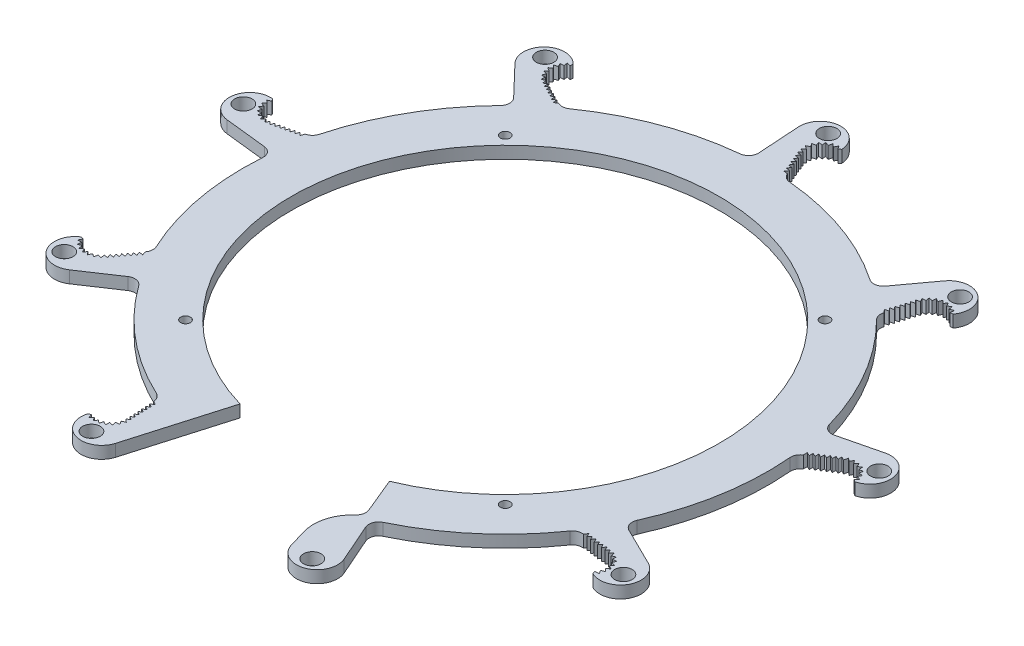
from build123d import *

# Parameters (mm, degrees)
SKETCH1_R           = 68.58
SKETCH1_R_2         = 55.88
BOSS_EXTRUDE1_DEPTH = 3.175
BOSS_EXTRUDE2_START = -3.175
BOSS_EXTRUDE2_DEPTH = 3.175
CIRPATTERN1_COUNT   = 9
SKETCH4_R           = 1.27
CUT_EXTRUDE1_DEPTH  = 124.088082607
CIRPATTERN14_COUNT  = 4
CUT_EXTRUDE4_DEPTH  = 124.088082607
BOSS_EXTRUDE4_START = -3.175
BOSS_EXTRUDE4_DEPTH = 3.175
SKETCH11_R          = 0.0635
CUT_EXTRUDE6_DEPTH  = 124.088082607
CRVPATTERN8_DEPTH   = 3.175
CIRPATTERN15_COUNT  = 9
CUT_EXTRUDE7_DEPTH  = 124.088082607
SKETCH3_R           = 2.286
CUT_EXTRUDE8_DEPTH  = 124.088082607
CIRPATTERN16_COUNT  = 9


# Read off the part's stored shape, not the designer's step: CrvPattern8
with BuildPart() as part:
    # Sketch1 → Boss-Extrude1 (new body)
    with BuildSketch(Plane(origin=(0, 0, 0), x_dir=(1, 0, 0), z_dir=(0, 1, 0))):
        with Locations(Location((0, 0, 0), (0, 0, 270))):
            Circle(SKETCH1_R)
        with Locations(Location((0, 0, 0), (0, 0, 270))):
            Circle(SKETCH1_R_2, mode=Mode.SUBTRACT)
    extrude(amount=BOSS_EXTRUDE1_DEPTH)

    # Sketch2 → Boss-Extrude2 (add)
    with BuildSketch(Plane(origin=(0, 3.175, 0), x_dir=(1, 0, 0), z_dir=(0, 1, 0)).offset(BOSS_EXTRUDE2_START)):
        with BuildLine():
            Line((-4.648503105, 70.922452149), (-5.367925957, 81.898723786))
            ThreePointArc((-5.367925957, 81.898723786), (0, 87.63), (5.367925957, 81.898723786))
            ThreePointArc((5.367925957, 81.898723786), (1.585103244, 80.66312392), (0.966324082, 76.732021396))
            Line((0.966324082, 76.732021396), (3.81, 69.87951531))
            ThreePointArc((3.81, 69.87951531), (4.65537594, 68.803759817), (5.936157335, 68.322605601))
            ThreePointArc((5.936157335, 68.322605601), (-0.497376724, 68.578196363), (-6.926526743, 68.22931648))
            ThreePointArc((-6.926526743, 68.22931648), (-5.243785443, 69.115963701), (-4.648503105, 70.922452149))
        make_face()
    boss_extrude2 = extrude(amount=BOSS_EXTRUDE2_DEPTH)

    # CirPattern1: Boss-Extrude2 ×9 about axis
    cirpattern1_axis = Axis((0, 0, 0), (0, 1, 0))
    for i in range(1, CIRPATTERN1_COUNT):
        add(boss_extrude2.rotate(cirpattern1_axis, i * 360 / CIRPATTERN1_COUNT))

    # Sketch4 → Cut-Extrude1 (cut, through all)
    with BuildSketch(Plane(origin=(0, 3.175, 0), x_dir=(1, 0, 0), z_dir=(0, 1, 0))):
        with Locations(Location((41.758190963, 41.758190963, 0), (0, 0, 270))):
            Circle(SKETCH4_R)
    cut_extrude1 = extrude(amount=-CUT_EXTRUDE1_DEPTH, mode=Mode.SUBTRACT)

    # CirPattern14: Cut-Extrude1 ×4 about axis
    cirpattern14_axis = Axis((0, 0, 0), (0, 1, 0))
    for i in range(1, CIRPATTERN14_COUNT):
        add(cut_extrude1.rotate(cirpattern14_axis, i * 360 / CIRPATTERN14_COUNT), mode=Mode.SUBTRACT)

    # Sketch5 → Cut-Extrude4 (cut, through all)
    with BuildSketch(Plane(origin=(0, 3.175, 0), x_dir=(1, 0, 0), z_dir=(0, 1, 0))):
        with BuildLine():
            Line((-19.888743183, -68.235186631), (-15.636845304, -53.647585863))
            ThreePointArc((-15.636845304, -53.647585863), (0, -55.88), (15.636845304, -53.647585863))
            Line((15.636845304, -53.647585863), (19.325186954, -66.301712798))
            ThreePointArc((19.325186954, -66.301712798), (18.562724528, -66.148163934), (17.789544117, -66.232533699))
            ThreePointArc((17.789544117, -66.232533699), (0.497376724, -68.578196363), (-16.826994534, -66.483596887))
            ThreePointArc((-16.826994534, -66.483596887), (-18.711505325, -66.741241317), (-19.888743183, -68.235186631))
        make_face()
    extrude(amount=-CUT_EXTRUDE4_DEPTH, mode=Mode.SUBTRACT)

    # Sketch8 → Boss-Extrude4 (add)
    with BuildSketch(Plane(origin=(0, 3.175, 0), x_dir=(1, 0, 0), z_dir=(0, 1, 0)).offset(BOSS_EXTRUDE4_START)):
        with BuildLine():
            Line((20.319972957, -66.968361627), (25.335849347, -72.435016585))
            ThreePointArc((25.335849347, -72.435016585), (26.098903382, -76.340679556), (22.966812837, -78.795565198))
            Line((22.966812837, -78.795565198), (19.325186954, -66.301712798))
            ThreePointArc((19.325186954, -66.301712798), (19.862428642, -66.575574248), (20.319972957, -66.968361627))
        make_face()
    extrude(amount=BOSS_EXTRUDE4_DEPTH)

    # Sketch11 → Cut-Extrude6 (cut, through all)
    with BuildSketch(Plane(origin=(0, 3.175, 0), x_dir=(1, 0, 0), z_dir=(0, 1, 0))):
        with Locations((4.474572189, 71.558672285)):
            Circle(SKETCH11_R)
        Polygon((3.47094583, 71.027887706), (3.957724412, 69.854880199), (2.775929115, 70.051961086), align=None)
    cut_extrude6 = extrude(amount=-CUT_EXTRUDE6_DEPTH, mode=Mode.SUBTRACT)

    # CrvPattern8 outline → CrvPattern8 (cut)
    with BuildSketch(Plane(origin=(0, 0, 0), x_dir=(1, 0, 0), z_dir=(0, 1, 0))):
        with BuildLine():
            Line((2.954390649, 71.893612642), (2.35875647, 71.057236713))
            Line((2.35875647, 71.057236713), (3.371563294, 70.888337016))
            Line((3.371563294, 70.888337016), (3.38406874, 70.905896878))
            Line((3.38406874, 70.905896878), (0.966324082, 76.732021396))
            ThreePointArc((0.966324082, 76.732021396), (1.585103244, 80.66312392), (5.367925957, 81.898723786))
            ThreePointArc((5.367925957, 81.898723786), (5.37940733, 82.230759048), (5.370370135, 82.562869823))
            Line((5.370370135, 82.562869823), (4.835817307, 82.035720051))
            Line((4.835817307, 82.035720051), (4.241589962, 82.88503055))
            Line((4.241589962, 82.88503055), (3.738556552, 81.978723842))
            Line((3.738556552, 81.978723842), (2.929076067, 82.62616172))
            Line((2.929076067, 82.62616172), (2.701825603, 81.614830079))
            Line((2.701825603, 81.614830079), (1.74270305, 82.007918354))
            Line((1.74270305, 82.007918354), (1.809654933, 80.973533557))
            Line((1.809654933, 80.973533557), (0.778630371, 81.080411122))
            Line((0.778630371, 81.080411122), (1.13435793, 80.106813481))
            Line((1.13435793, 80.106813481), (0.114999311, 79.918817556))
            Line((0.114999311, 79.918817556), (0.73066965, 79.084920383))
            Line((0.73066965, 79.084920383), (-0.194400635, 78.617288659))
            Line((-0.194400635, 78.617288659), (0.631310365, 77.990682079))
            Line((0.631310365, 77.990682079), (-0.124491578, 77.281317657))
            Line((-0.124491578, 77.281317657), (0.859335479, 76.907083655))
            Line((0.859335479, 76.907083655), (0.272893244, 76.083614844))
            Line((0.272893244, 76.083614844), (1.285700068, 75.914715147))
            Line((1.285700068, 75.914715147), (0.690065889, 75.078339218))
            Line((0.690065889, 75.078339218), (1.702872713, 74.909439521))
            Line((1.702872713, 74.909439521), (1.107238535, 74.073063591))
            Line((1.107238535, 74.073063591), (2.120045358, 73.904163894))
            Line((2.120045358, 73.904163894), (1.52441118, 73.067787965))
            Line((1.52441118, 73.067787965), (2.537218003, 72.898888268))
            Line((2.537218003, 72.898888268), (1.941583825, 72.062512339))
            Line((1.941583825, 72.062512339), (2.954390649, 71.893612642))
        make_face()
    crvpattern8 = extrude(amount=CRVPATTERN8_DEPTH, mode=Mode.SUBTRACT)

    # CirPattern15: Cut-Extrude6, CrvPattern8 ×9 about axis, 1 skipped
    cirpattern15_axis = Axis((0, 0, 0), (0, -1, 0))
    add([cut_extrude6.rotate(cirpattern15_axis, i * 360 / CIRPATTERN15_COUNT) for i in range(1, CIRPATTERN15_COUNT) if i not in (4,)], mode=Mode.SUBTRACT)
    add([crvpattern8.rotate(cirpattern15_axis, i * 360 / CIRPATTERN15_COUNT) for i in range(1, CIRPATTERN15_COUNT) if i not in (4,)], mode=Mode.SUBTRACT)

    # Sketch12 → Cut-Extrude7 (cut, through all)
    with BuildSketch(Plane(origin=(0, 3.175, 0), x_dir=(1, 0, 0), z_dir=(0, 1, 0))):
        with BuildLine():
            Line((21.595205823, -74.08979472), (15.636845304, -53.647585863))
            ThreePointArc((15.636845304, -53.647585863), (18.538164393, -52.715375944), (21.384350201, -51.626388277))
            Line((21.384350201, -51.626388277), (25.199034926, -60.835851878))
            ThreePointArc((25.199034926, -60.835851878), (25.329719898, -62.368574098), (24.5517672, -63.695640624))
            ThreePointArc((24.5517672, -63.695640624), (21.576958326, -68.467038257), (21.595205823, -74.08979472))
        make_face()
    extrude(amount=-CUT_EXTRUDE7_DEPTH, mode=Mode.SUBTRACT)

    # Sketch3 → Cut-Extrude8 (cut, through all)
    with BuildSketch(Plane(origin=(0, 3.175, 0), x_dir=(1, 0, 0), z_dir=(0, 1, 0))):
        with Locations(Location((0, 84.328, 0), (0, 0, 270))):
            Circle(SKETCH3_R)
    cut_extrude8 = extrude(amount=-CUT_EXTRUDE8_DEPTH, mode=Mode.SUBTRACT)

    # CirPattern16: Cut-Extrude8 ×9 about axis
    cirpattern16_axis = Axis((0, 0, 0), (0, 1, 0))
    for i in range(1, CIRPATTERN16_COUNT):
        add(cut_extrude8.rotate(cirpattern16_axis, i * 360 / CIRPATTERN16_COUNT), mode=Mode.SUBTRACT)


solid = part.part
